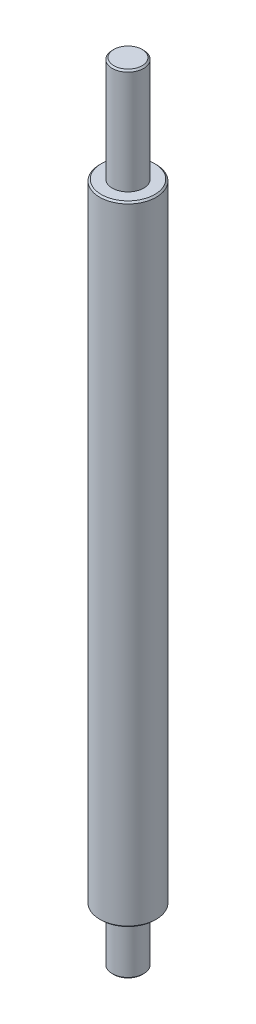
from build123d import *

# Parameters (mm, degrees)
CHAMFER_1_SIZE                 = 0.5
HOLE_WIZARD_6_0_6_1_AT_2_COUNT = 2
HOLE_WIZARD_6_0_6_1_AT_2_PITCH = 48
HOLE_WIZARD_6_0_6_1_AT_3_COUNT = 2
HOLE_WIZARD_6_0_6_1_AT_3_PITCH = 113
HOLE_WIZARD_6_0_6_1_AT_4_COUNT = 2
HOLE_WIZARD_6_0_6_1_AT_4_PITCH = 161
PATTERN_CIRCULAR_1_COUNT       = 2
PATTERN_CIRCULAR_1_ANGLE       = 90


with BuildPart() as part:
    # 草图1 → 旋转1 (revolve)
    with BuildSketch(Plane.XY):
        Polygon((0, 0), (0, -250.5), (-5, -250.5), (-5, -233.5), (-9, -233.5), (-9, -33.5), (-5, -33.5), (-5, 0), align=None)
    revolve(axis=Axis((0, 0, 0), (0, -1, 0)))

    # 倒角1
    chamfer_1_edges = [part.edges().sort_by_distance(p)[0] for p in [
        (5, -250.5, 0),
        (5, 0, 0),
        (9, -233.5, 0),
        (9, -33.5, 0),
    ]]
    chamfer(chamfer_1_edges, length=CHAMFER_1_SIZE)

    # 草图5 → Ø6.0 (6) 直径孔1 (revolve, cut)
    with BuildSketch(Plane(origin=(0, -214, -9), x_dir=(0, 1, 0), z_dir=(1, 0, 0))):
        Polygon((0, 0), (0, 3.802581857), (3, 2), (3, 0), align=None)
    hole_wizard_6_0_6_1 = revolve(axis=Axis((0, -214, -15.35), (0, 0, 1)), mode=Mode.SUBTRACT)

    # Ø6.0 (6) 直径孔1 at 2: Ø6.0 (6) 直径孔1 ×2
    with Locations(*[(0, i * HOLE_WIZARD_6_0_6_1_AT_2_PITCH, 0) for i in range(1, HOLE_WIZARD_6_0_6_1_AT_2_COUNT)]):
        add(hole_wizard_6_0_6_1, mode=Mode.SUBTRACT)

    # Ø6.0 (6) 直径孔1 at 3: Ø6.0 (6) 直径孔1 ×2
    with Locations(*[(0, i * HOLE_WIZARD_6_0_6_1_AT_3_PITCH, 0) for i in range(1, HOLE_WIZARD_6_0_6_1_AT_3_COUNT)]):
        add(hole_wizard_6_0_6_1, mode=Mode.SUBTRACT)

    # Ø6.0 (6) 直径孔1 at 4: Ø6.0 (6) 直径孔1 ×2
    with Locations(*[(0, i * HOLE_WIZARD_6_0_6_1_AT_4_PITCH, 0) for i in range(1, HOLE_WIZARD_6_0_6_1_AT_4_COUNT)]):
        add(hole_wizard_6_0_6_1, mode=Mode.SUBTRACT)

    # 阵列(圆周)1: Ø6.0 (6) 直径孔1 ×2 about axis
    pattern_circular_1_axis = Axis((0, 0, 0), (0, 1, 0))
    for i in range(1, PATTERN_CIRCULAR_1_COUNT):
        add(hole_wizard_6_0_6_1.rotate(pattern_circular_1_axis, i * PATTERN_CIRCULAR_1_ANGLE / (PATTERN_CIRCULAR_1_COUNT - 1)), mode=Mode.SUBTRACT)

    # 阵列(圆周)1 copy 1 sketch → 阵列(圆周)1 copy 1 (revolve, cut)
    with BuildSketch(Plane(origin=(-9, -166, 0), x_dir=(0, 1, 0), z_dir=(0, 0, -1))):
        Polygon((0, 0), (0, 3.802581857), (3, 2), (3, 0), align=None)
    revolve(axis=Axis((-15.35, -166, 0), (1, 0, 0)), mode=Mode.SUBTRACT)

    # 阵列(圆周)1 copy 2 sketch → 阵列(圆周)1 copy 2 (revolve, cut)
    with BuildSketch(Plane(origin=(-9, -101, 0), x_dir=(0, 1, 0), z_dir=(0, 0, -1))):
        Polygon((0, 0), (0, 3.802581857), (3, 2), (3, 0), align=None)
    revolve(axis=Axis((-15.35, -101, 0), (1, 0, 0)), mode=Mode.SUBTRACT)

    # 阵列(圆周)1 copy 3 sketch → 阵列(圆周)1 copy 3 (revolve, cut)
    with BuildSketch(Plane(origin=(-9, -53, 0), x_dir=(0, 1, 0), z_dir=(0, 0, -1))):
        Polygon((0, 0), (0, 3.802581857), (3, 2), (3, 0), align=None)
    revolve(axis=Axis((-15.35, -53, 0), (1, 0, 0)), mode=Mode.SUBTRACT)


solid = part.part
